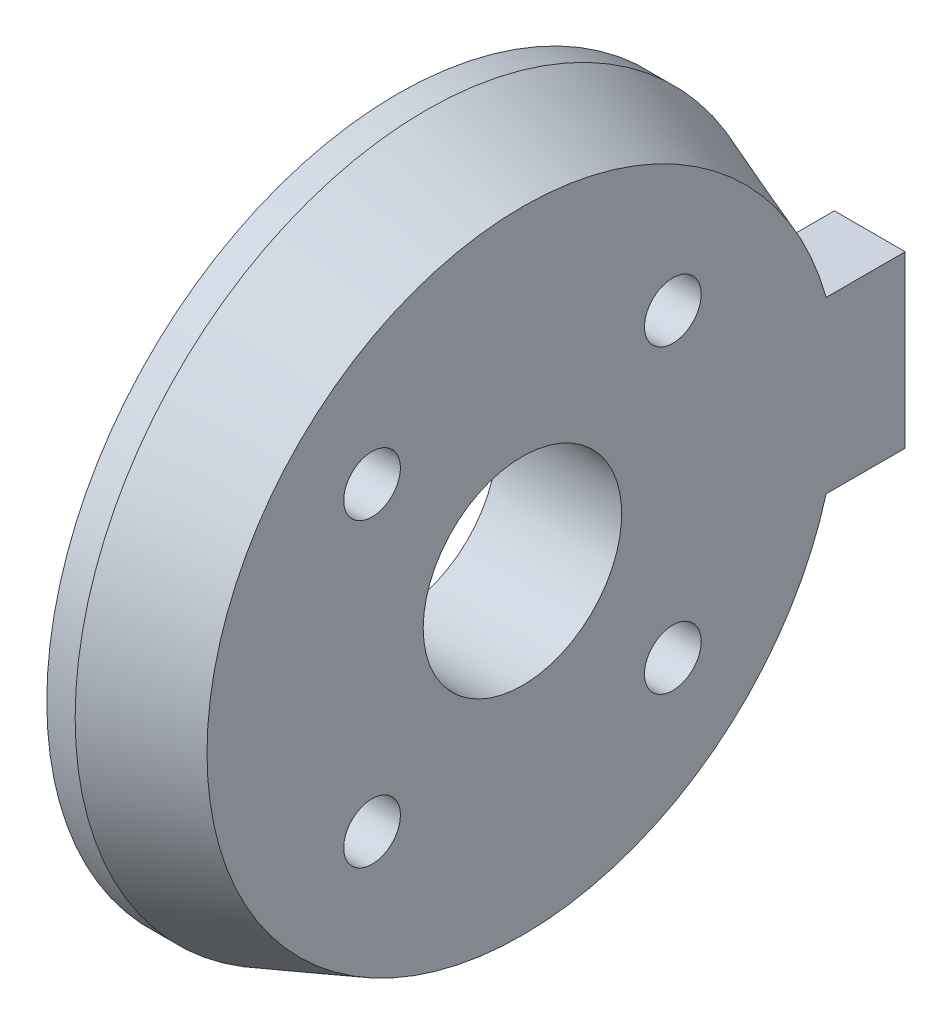
from build123d import *

# Parameters (mm, degrees)
SKETCH3_R           = 2
CUT_EXTRUDE1_DEPTH  = 5
SKETCH4_W           = 12
SKETCH4_H           = 12
BOSS_EXTRUDE1_DEPTH = 5


with BuildPart() as part:
    # Sketch2 → Revolve1 (revolve)
    with BuildSketch(Plane.XY):
        Polygon((0, 24.75), (2, 24.75), (8.8, 22.25), (8.8, 7), (0, 7), align=None)
    revolve(axis=Axis((0, 0, 0), (1, 0, 0)))

    # Sketch3 → Cut-Extrude1 (cut)
    with BuildSketch(Plane(origin=(8.8, 0, 0), x_dir=(0, 0, -1), z_dir=(1, 0, 0))):
        with Locations((10.606601718, 10.606601718)):
            Circle(SKETCH3_R)
        with Locations((10.606601718, -10.606601718)):
            Circle(SKETCH3_R)
        with Locations((-10.606601718, -10.606601718)):
            Circle(SKETCH3_R)
        with Locations((-10.606601718, 10.606601718)):
            Circle(SKETCH3_R)
    extrude(amount=-CUT_EXTRUDE1_DEPTH, mode=Mode.SUBTRACT)

    # Sketch4 → Boss-Extrude1 (add)
    with BuildSketch(Plane(origin=(8.8, 0, 0), x_dir=(0, 0, -1), z_dir=(1, 0, 0))):
        with Locations((21, 0)):
            Rectangle(SKETCH4_W, SKETCH4_H)
    extrude(amount=-BOSS_EXTRUDE1_DEPTH)


solid = part.part
